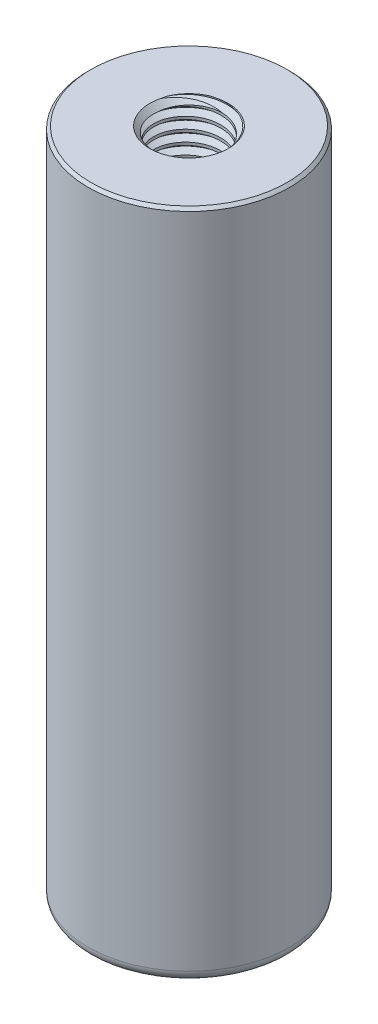
from build123d import *

# Parameters (mm, degrees)
SKETCH1_R           = 9
BOSS_EXTRUDE1_DEPTH = 60
SKETCH2_R           = 3
CUT_EXTRUDE1_DEPTH  = 10
SKETCH7_R           = 7
CUT_EXTRUDE2_DEPTH  = 50
CHAMFER1_SIZE       = 0.25
CHAMFER2_SIZE       = 0.5
THREAD2_PITCH       = 1
CHAMFER3_SIZE       = 1
FILLET1_R           = 1


with BuildPart() as part:
    # Sketch1 → Boss-Extrude1 (new body)
    with BuildSketch(Plane(origin=(0, 0, 0), x_dir=(1, 0, 0), z_dir=(0, 1, 0))):
        with Locations(Location((0, 0, 0), (0, 0, 270))):
            Circle(SKETCH1_R)
    extrude(amount=-BOSS_EXTRUDE1_DEPTH)

    # Sketch2 → Cut-Extrude1 (cut)
    with BuildSketch(Plane(origin=(0, 0, 0), x_dir=(1, 0, 0), z_dir=(0, 1, 0))):
        with Locations(Location((0, 0, 0), (0, 0, 270))):
            Circle(SKETCH2_R)
    extrude(amount=-CUT_EXTRUDE1_DEPTH, mode=Mode.SUBTRACT)

    # Sketch7 → Cut-Extrude2 (cut)
    with BuildSketch(Plane.XZ.offset(60)):
        with Locations(Location((0, 0, 0), (0, 0, 270))):
            Circle(SKETCH7_R)
    extrude(amount=-CUT_EXTRUDE2_DEPTH, mode=Mode.SUBTRACT)

    # Chamfer1
    chamfer1_edges = [part.edges().sort_by_distance(p)[0] for p in [
        (0, 0, -9),
    ]]
    chamfer(chamfer1_edges, length=CHAMFER1_SIZE)

    # Chamfer2
    chamfer2_edges = [part.edges().sort_by_distance(p)[0] for p in [
        (0, 0, -3),
    ]]
    chamfer(chamfer2_edges, length=CHAMFER2_SIZE)

    # Thread2: the profile of Thread Profile3 profile screwed along a right-hand helix of 12 turns, 8 arcs to a turn; built about Z, then put on its axis
    thread2_z = Axis((0, 0, 0), (0, 0, 1))
    thread2_corners = [(2.9997, 0, -0.000173205), (3.541265875, 0, 0.312499999), (3.541265875, 0, 0.437499999), (2.9997, 0, 0.750173202)]
    with BuildLine(mode=Mode.PRIVATE) as thread2_profile:
        Line(thread2_corners[0], thread2_corners[1])
        Line(thread2_corners[1], thread2_corners[2])
        Line(thread2_corners[2], thread2_corners[3])
        Line(thread2_corners[3], thread2_corners[0])
    thread2_cap = Face(thread2_profile.wire())
    thread2_turn_angles = [0, 22.5, 45, 67.5, 90, 112.5, 135, 157.5, 180, 202.5, 225, 247.5, 270, 292.5, 315, 337.5, 360]
    thread2_turn_weights = [1, 0.9238795325112867, 1, 0.9238795325112867, 1, 0.9238795325112867, 1, 0.9238795325112867, 1, 0.9238795325112867, 1, 0.9238795325112867, 1, 0.9238795325112867, 1, 0.9238795325112867, 1]
    thread2_turn_rails = [Edge.make_bspline([Vector(p[0], p[1], 0).rotate(thread2_z, thread2_turn_angles[k]) / thread2_turn_weights[k] + Vector(0, 0, p[2] + THREAD2_PITCH * thread2_turn_angles[k] / 360) for k in range(17)], [0, 0, 0, 1, 1, 2, 2, 3, 3, 4, 4, 5, 5, 6, 6, 7, 7, 8, 8, 8], 2, thread2_turn_weights) for p in thread2_corners]
    thread2_turn_sides = [Face.make_surface_from_curves(thread2_turn_rails[p[0]], thread2_turn_rails[p[1]]) for p in [(0, 1), (1, 2), (2, 3), (3, 0)]]
    thread2 = Plane(origin=(0, 1.5, 0), x_dir=(-1, 0, 0), z_dir=(0, -1, 0)) * Solid(Shell([*[p.moved(Location((0, 0, THREAD2_PITCH * i))) for i in range(12) for p in thread2_turn_sides], thread2_cap, thread2_cap.rotate(thread2_z, 4320).moved(Location((0, 0, THREAD2_PITCH * 4320 / 360)))]))
    add(thread2, mode=Mode.SUBTRACT)

    # Chamfer3
    chamfer3_edges = [part.edges().sort_by_distance(p)[0] for p in [
        (0, -10, 7),
        (0, -60, 7),
    ]]
    chamfer(chamfer3_edges, length=CHAMFER3_SIZE)

    # Fillet1
    fillet1_edges = [part.edges().sort_by_distance(p)[0] for p in [
        (0, -60, -9),
    ]]
    fillet(fillet1_edges, radius=FILLET1_R - 0.0001)  # a hair under: the kernel refuses the full size


solid = part.part
